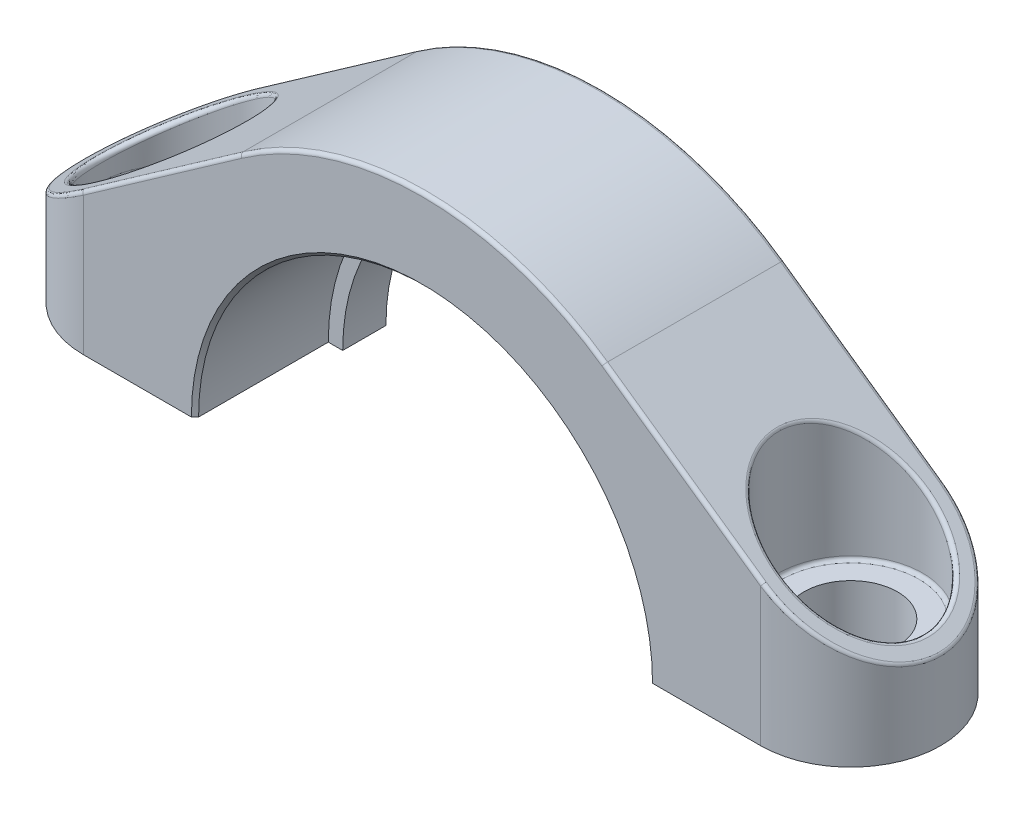
from build123d import *

# Parameters (mm, degrees)
SKETCH1_R           = 3.302
BOSS_EXTRUDE1_DEPTH = 21.844
CUT_EXTRUDE1_START  = -12.7
CUT_EXTRUDE1_DEPTH  = 12.7
CUT_EXTRUDE2_START  = 4.572
SKETCH3_R           = 5.08
CUT_EXTRUDE2_DEPTH  = 21.844
FILLET1_R           = 0.254
CUT_EXTRUDE3_DEPTH  = 9.398
SKETCH5_R           = 14.986
CUT_EXTRUDE4_DEPTH  = 17.78
CHAMFER1_SIZE       = 0.254


with BuildPart() as part:
    # Sketch1 → Boss-Extrude1 (new body)
    with BuildSketch(Plane(origin=(0, 0, 0), x_dir=(1, 0, 0), z_dir=(0, 1, 0))):
        with BuildLine():
            Line((-23.876, 6.35), (23.876, 6.35))
            ThreePointArc((23.876, 6.35), (30.226, 0), (23.876, -6.35))
            Line((23.876, -6.35), (-23.876, -6.35))
            ThreePointArc((-23.876, -6.35), (-30.226, 0), (-23.876, 6.35))
        make_face()
        with Locations(Location((-23.876, 0, 0), (0, 0, 270))):
            Circle(SKETCH1_R, mode=Mode.SUBTRACT)
        with Locations(Location((23.876, 0, 0), (0, 0, 270))):
            Circle(SKETCH1_R, mode=Mode.SUBTRACT)
    extrude(amount=BOSS_EXTRUDE1_DEPTH)

    # Cut-Extrude1: read off the stored shape, not the designer's step
    # Cut-Extrude1 outline → Cut-Extrude1 (cut)
    with BuildSketch(Plane.XY.offset(6.35).offset(CUT_EXTRUDE1_START)):
        with BuildLine():
            ThreePointArc((1.04e-07, 21.844), (6.732172344, 20.806074212), (12.839121331, 17.788690068))
            Line((12.839121331, 17.788690068), (30.226, 5.588))
            Line((30.226, 5.588), (32, 4.343151825))
            Line((32, 4.343151825), (32, 21.844))
            Line((32, 21.844), (1.04e-07, 21.844))
        make_face()
        with BuildLine():
            ThreePointArc((-12.839121331, 17.788690068), (-6.732172244, 20.806074244), (1.04e-07, 21.844))
            Line((1.04e-07, 21.844), (-32, 21.844))
            Line((-32, 21.844), (-32, 4.343151825))
            Line((-32, 4.343151825), (-30.226, 5.588))
            Line((-30.226, 5.588), (-12.839121331, 17.788690068))
        make_face()
    extrude(amount=CUT_EXTRUDE1_DEPTH, mode=Mode.SUBTRACT)

    # Sketch3 → Cut-Extrude2 (cut)
    with BuildSketch(Plane(origin=(0, 0, 0), x_dir=(1, 0, 0), z_dir=(0, 1, 0)).offset(CUT_EXTRUDE2_START)):
        with Locations(Location((-23.876, 0, 0), (0, 0, 180))):
            Circle(SKETCH3_R)
    cut_extrude2 = extrude(amount=CUT_EXTRUDE2_DEPTH, mode=Mode.SUBTRACT)

    # Mirror1: Cut-Extrude2 across plane
    add(cut_extrude2.mirror(Plane(origin=(0, 0, 0), x_dir=(0, 0, 1), z_dir=(1, 0, 0))), mode=Mode.SUBTRACT)

    # Fillet1
    fillet1_edges = [part.edges().sort_by_distance(p)[0] for p in [
        (-6.732172245, 20.806074244, -6.35),
        (-18.357560666, 13.916300477, 6.35),
        (-6.732172245, 20.806074244, 6.35),
        (18.357560665, 13.916300477, 6.35),
        (28.139330871, 7.052253809, 4.70600785),
        (-28.139330871, 7.052253809, -4.70600785),
        (-18.357560666, 13.916300477, -6.35),
        (18.357560665, 13.916300477, -6.35),
        (-18.796000032, 13.608639572, -0.000566156),
        (-18.796, 4.572, 0),
        (18.796000032, 13.608639572, 0.000566156),
        (18.796, 4.572, 0),
    ]]
    fillet(fillet1_edges, radius=FILLET1_R)

    # Sketch4 → Cut-Extrude3 (cut)
    with BuildSketch(Plane.XY.offset(6.35)):
        with BuildLine():
            Line((-16.002, 0), (16.002, 0))
            ThreePointArc((16.002, 0), (0, 16.002), (-16.002, 0))
        make_face()
        with BuildLine():
            ThreePointArc((-16.002, 0), (0, -16.002), (16.002, 0))
            Line((16.002, 0), (-16.002, 0))
        make_face()
    extrude(amount=-CUT_EXTRUDE3_DEPTH, mode=Mode.SUBTRACT)

    # Sketch5 → Cut-Extrude4 (cut)
    with BuildSketch(Plane.XY.offset(-3.048)):
        Circle(SKETCH5_R)
    extrude(amount=-CUT_EXTRUDE4_DEPTH, mode=Mode.SUBTRACT)

    # Chamfer1
    chamfer1_edges = [part.edges().sort_by_distance(p)[0] for p in [
        (0, 16.002, 6.35),
        (0, 14.986, -6.35),
    ]]
    chamfer(chamfer1_edges, length=CHAMFER1_SIZE)


solid = part.part
